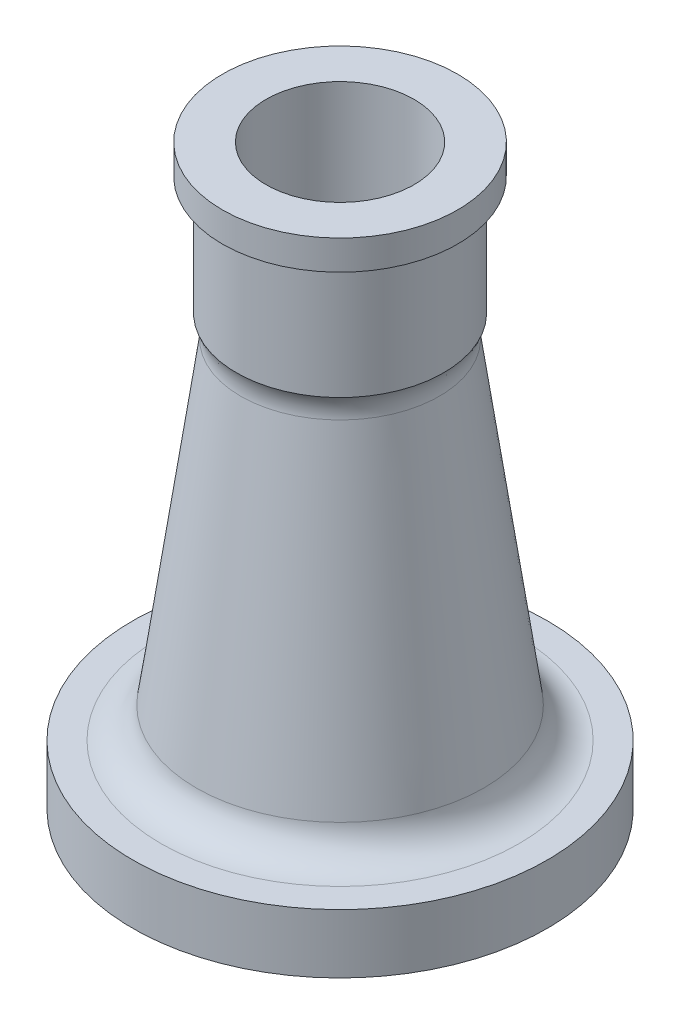
from build123d import *

# Parameters (mm, degrees)
FILLET1_R = 12
FILLET2_R = 12


with BuildPart() as part:
    # Sketch2 → Revolve-Thin2 (revolve)
    with BuildSketch(Plane.XY, mode=Mode.PRIVATE) as revolve_thin2_sk:
        Polygon((39.725895331, 131.026369151), (35, 131.026369151), (35, 91.026369151), (32.5, 91.026369151), (50, -33.973630849), (70, -33.973630849), (70, -53.973630849), (60, -53.973630849), (60, -43.973630849), (41.302475551, -43.973630849), (21.002475551, 101.026369151), (25, 101.026369151), (25, 141.026369151), (39.725895331, 141.026369151), align=None)
    revolve(revolve_thin2_sk.sketch.rotate(Axis((0, -92.5, 0), (0, 1, 0)), 90), axis=Axis((0, -92.5, 0), (0, 1, 0)))

    # Fillet1
    # the kernel refuses this fillet: 12 mm, written as the material it adds along each edge
    with BuildSketch(Plane(origin=(0, 91.026369151, 0), x_dir=(0, 0, -1), z_dir=(1, 0, 0))) as fillet1_piece_1:
        with BuildLine():
            CenterArc((45.444294459, -5.909036575), FILLET1_R, 150.500253151, 37.469357243)
            Line((33.560193499, -7.572810709), (33.32251148, -7.606086192))
            Line((33.32251148, -7.606086192), (32.262317981, -0.033275483))
            Line((32.262317981, -0.033275483), (32.5, 0.24))
            ThreePointArc((32.5, 0.24), (33.75, 0.24), (34.791114111, 0.118180731))
            Line((34.791114111, 0.118180731), (35, 0))
        make_face()
    revolve(axis=Axis((0, 91.026369151, 0), (0, 1, 0)))

    # Fillet2
    fillet2_edges = [part.edges().sort_by_distance(p)[0] for p in [
        (0, -33.973630849, 50),
    ]]
    fillet(fillet2_edges, radius=FILLET2_R)


solid = part.part
